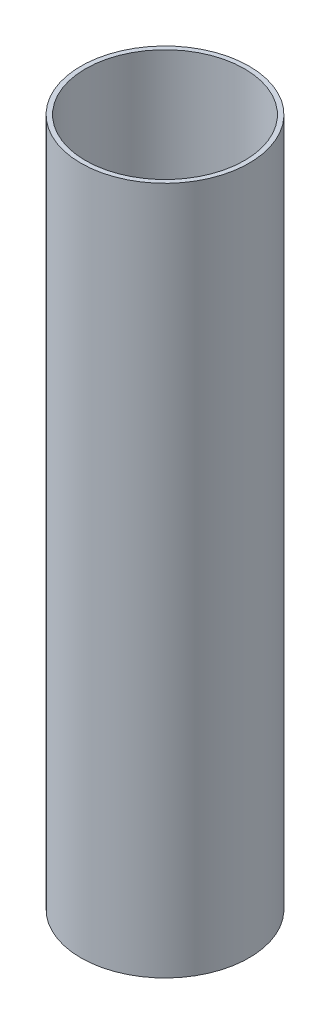
from build123d import *

# Parameters (mm, degrees)
SKETCH1_R           = 55
SKETCH1_R_2         = 52
BOSS_EXTRUDE1_DEPTH = 450


with BuildPart() as part:
    # Sketch1 → Boss-Extrude1 (new body)
    with BuildSketch(Plane(origin=(0, 0, 0), x_dir=(1, 0, 0), z_dir=(0, 1, 0))):
        Circle(SKETCH1_R)
        Circle(SKETCH1_R_2, mode=Mode.SUBTRACT)
    extrude(amount=BOSS_EXTRUDE1_DEPTH)


solid = part.part
